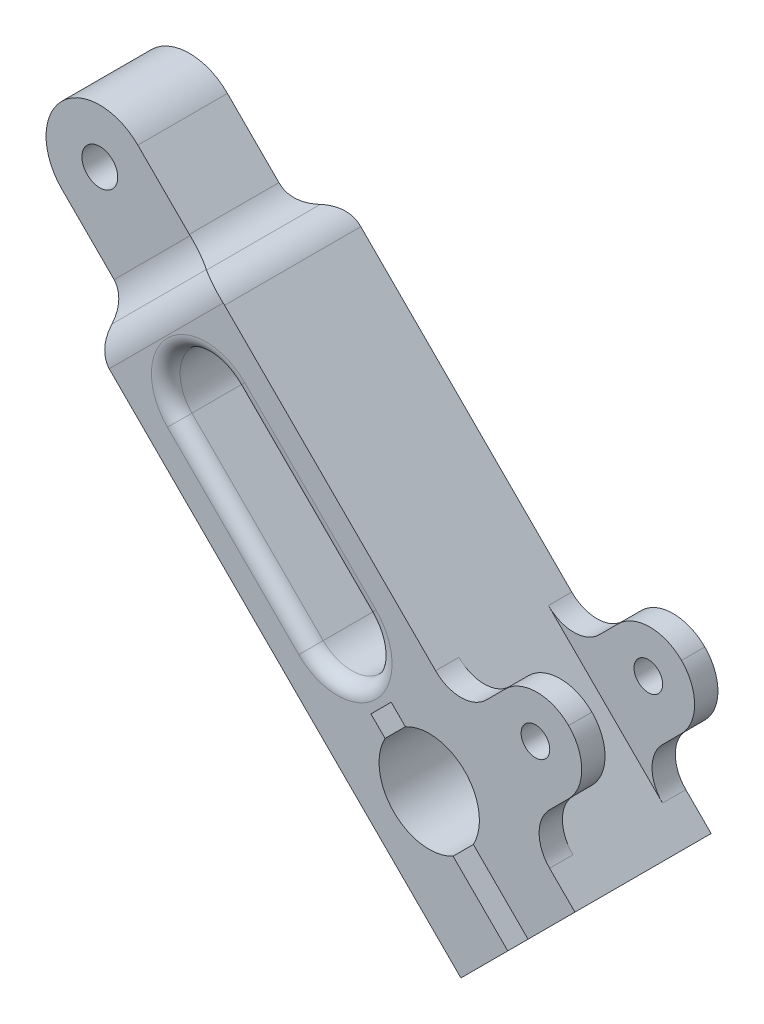
from build123d import *

# Parameters (mm, degrees)
BOSS_EXTRUDE1_DEPTH  = 38
SKETCH2_3_R          = 4
BOSS_EXTRUDE2_DEPTH  = 6.5
FILLET1_R            = 12.5
FILLET1_OF_MIRROR1_R = 12.5
SKETCH3_W            = 25
SKETCH3_H            = 30
BOSS_EXTRUDE3_DEPTH  = 45
SKETCH4_R            = 5
CUT_EXTRUDE1_DEPTH   = 231.178375709
FILLET2_R            = 15
SKETCH5_R            = 4
CUT_EXTRUDE2_DEPTH   = 10
FILLET3_R            = 10
FILLET4_R            = 10
CUT_EXTRUDE3_DEPTH   = 232.157597002
FILLET5_R            = 4


# Some blends are built 0.0001 mm under size
with BuildPart() as part:
    # Sketch2 → Boss-Extrude1 (new body)
    with BuildSketch(Plane.XY):
        with BuildLine():
            ThreePointArc((131.936514279, -126.279660029), (129.52074911, -109.721759237), (112.962848318, -107.305994068))
            Line((112.962848318, -107.305994068), (109.014652456, -103.357798206))
            Line((109.014652456, -103.357798206), (103.357798206, -109.014652456))
            Line((103.357798206, -109.014652456), (107.305994068, -112.962848318))
            ThreePointArc((107.305994068, -112.962848318), (109.721759237, -129.52074911), (126.279660029, -131.936514279))
            Line((126.279660029, -131.936514279), (141.54156439, -147.19841864))
            Line((141.54156439, -147.19841864), (128.460088938, -160.279894092))
            Line((128.460088938, -160.279894092), (114.317953314, -146.137758468))
            Line((114.317953314, -146.137758468), (26.516504294, -58.336309448))
            Line((26.516504294, -58.336309448), (31.819805153, -53.033008589))
            Line((31.819805153, -53.033008589), (53.033008589, -31.819805153))
            Line((53.033008589, -31.819805153), (58.336309448, -26.516504294))
            Line((58.336309448, -26.516504294), (128.460088938, -96.640283785))
            Line((128.460088938, -96.640283785), (146.137758468, -114.317953314))
            Line((146.137758468, -114.317953314), (160.279894092, -128.460088938))
            Line((160.279894092, -128.460088938), (147.19841864, -141.54156439))
            Line((147.19841864, -141.54156439), (131.936514279, -126.279660029))
        make_face()
    extrude(amount=BOSS_EXTRUDE1_DEPTH)

    # Sketch2<3> → Boss-Extrude2 (add)
    with BuildSketch(Plane.XY):
        Polygon((149.673292374, -75.427080349), (128.460088938, -96.640283785), (146.137758468, -114.317953314), (167.350961903, -93.104749879), align=None)
        with Locations(Location((149.25239548, -92.683852985, 0), (0, 0, 180))):
            Circle(SKETCH2_3_R, mode=Mode.SUBTRACT)
    boss_extrude2 = extrude(amount=BOSS_EXTRUDE2_DEPTH)

    # Fillet1
    fillet1_edges = [part.edges().sort_by_distance(p)[0] for p in [
        (167.350961903, -93.104749879, 3.25),
        (149.673292374, -75.427080349, 3.25),
    ]]
    fillet(fillet1_edges, radius=FILLET1_R - 0.0001)  # a hair under: the kernel refuses the full size

    # Mirror1: Boss-Extrude2 across plane
    add(boss_extrude2.mirror(Plane(origin=(0, 0, 19), x_dir=(1, 0, 0), z_dir=(0, 0, -1))))

    # Fillet1 of Mirror1
    fillet1_of_mirror1_edges = [part.edges().sort_by_distance(p)[0] for p in [
        (167.350961903, -93.104749879, 34.75),
        (149.673292374, -75.427080349, 34.75),
    ]]
    fillet(fillet1_of_mirror1_edges, radius=FILLET1_OF_MIRROR1_R - 0.0001)  # a hair under: the kernel refuses the full size

    # Sketch3 → Boss-Extrude3 (add)
    with BuildSketch(Plane(origin=(42.426406871, -42.426406871, 0), x_dir=(0, 0, 1), z_dir=(-0.7071067811865493, 0.7071067811865457, 0))):
        with Locations((19, 0)):
            Rectangle(SKETCH3_W, SKETCH3_H)
    extrude(amount=BOSS_EXTRUDE3_DEPTH)

    # Sketch4 → Cut-Extrude1 (cut, through all)
    with BuildSketch(Plane.XY.offset(31.5)):
        with Locations((21.213203436, -21.213203436)):
            Circle(SKETCH4_R)
    extrude(amount=-CUT_EXTRUDE1_DEPTH, mode=Mode.SUBTRACT)

    # Fillet2
    fillet2_edges = [part.edges().sort_by_distance(p)[0] for p in [
        (21.213203436, 0, 19),
        (0, -21.213203436, 19),
    ]]
    fillet(fillet2_edges, radius=FILLET2_R - 0.0001)  # a hair under: the kernel refuses the full size

    # Sketch5 → Cut-Extrude2 (cut)
    with BuildSketch(Plane(origin=(144.369991515, -144.369991515, 0), x_dir=(0, 0, -1), z_dir=(0.7071067811865477, -0.7071067811865475, 0))):
        with Locations(Location((-27, -13.25, 0), (0, 0, 90))):
            Circle(SKETCH5_R)
        with Locations(Location((-13, -13.25, 0), (0, 0, 90))):
            Circle(SKETCH5_R)
    extrude(amount=-CUT_EXTRUDE2_DEPTH, mode=Mode.SUBTRACT)

    # Fillet3
    # the kernel refuses this fillet: 10 mm, written as the material it adds along each edge
    with BuildSketch(Plane(origin=(128.460088938, -96.640283785, 0), x_dir=(-0.7071067811865476, 0.7071067811865476, 0), z_dir=(0, 0, 1)), Plane(origin=(146.137758468, -114.317953314, 38), x_dir=(0.7071067811865482, -0.7071067811865468, 0), z_dir=(0, 0, -1))) as fillet3_piece_1:
        with BuildLine():
            CenterArc((FILLET3_R, -FILLET3_R), FILLET3_R, 90, 90)
            Line((0, -FILLET3_R), (-FILLET3_R * 0.02, -FILLET3_R))
            Line((-FILLET3_R * 0.02, -FILLET3_R), (-FILLET3_R * 0.02, FILLET3_R * 0.02))
            Line((-FILLET3_R * 0.02, FILLET3_R * 0.02), (FILLET3_R, FILLET3_R * 0.02))
            Line((FILLET3_R, FILLET3_R * 0.02), (FILLET3_R, 0))
        make_face()
    extrude(amount=6.5)
    with BuildSketch(Plane(origin=(146.137758468, -114.317953314, 0), x_dir=(0.7071067811865482, -0.7071067811865468, 0), z_dir=(0, 0, 1)), Plane(origin=(128.460088938, -96.640283785, 38), x_dir=(-0.7071067811865476, 0.7071067811865476, 0), z_dir=(0, 0, -1))) as fillet3_piece_2:
        with BuildLine():
            CenterArc((FILLET3_R, FILLET3_R), FILLET3_R, 180, 90)
            Line((0, FILLET3_R), (-FILLET3_R * 0.02, FILLET3_R))
            Line((-FILLET3_R * 0.02, FILLET3_R), (-FILLET3_R * 0.02, -FILLET3_R * 0.02))
            Line((-FILLET3_R * 0.02, -FILLET3_R * 0.02), (FILLET3_R, -FILLET3_R * 0.02))
            Line((FILLET3_R, -FILLET3_R * 0.02), (FILLET3_R, 0))
        make_face()
    extrude(amount=6.5)
    with BuildSketch(Plane(origin=(53.033008589, -31.819805153, 31.5), x_dir=(0, 0, 1), z_dir=(-0.7071067811865457, -0.7071067811865493, 0))) as fillet3_piece_3:
        with BuildLine():
            CenterArc((10, 9.367496998), FILLET3_R, 180, 69.512684885)
            Line((0, 9.367496998), (-0.2, 9.367496998))
            Line((-0.2, 9.367496998), (-0.2, 0))
            Line((-0.2, 0), (0, -0.2))
            ThreePointArc((0, -0.2), (3.25, -0.2), (6.43, -0.18734994))
            Line((6.43, -0.18734994), (6.5, 0))
        make_face()
    extrude(amount=30)
    with BuildSketch(Plane(origin=(53.033008589, -31.819805153, 6.5), x_dir=(0.7071067811865468, 0.7071067811865482, 0), z_dir=(0, 0, 1))) as fillet3_piece_4:
        with BuildLine():
            CenterArc((10, 9.682458366), FILLET3_R, 180, 75.522487814)
            Line((0, 9.682458366), (-0.2, 9.682458366))
            Line((-0.2, 9.682458366), (-0.2, 0))
            Line((-0.2, 0), (0, -0.2))
            ThreePointArc((0, -0.2), (3.75, -0.2), (7.45, -0.193649167))
            Line((7.45, -0.193649167), (7.5, 0))
        make_face()
    extrude(amount=25)
    with BuildSketch(Plane(origin=(31.819805153, -53.033008589, 6.5), x_dir=(-0.7071067811865493, 0.7071067811865456, 0), z_dir=(0.7071067811865457, 0.7071067811865493, 0))) as fillet3_piece_5:
        with BuildLine():
            CenterArc((9.367496998, -10), FILLET3_R, 90, 69.512684885)
            Line((0, -6.5), (-0.18734994, -6.43))
            ThreePointArc((-0.18734994, -6.43), (-0.2, -3.25), (-0.2, 0))
            Line((-0.2, 0), (0, 0.2))
            Line((0, 0.2), (9.367496998, 0.2))
            Line((9.367496998, 0.2), (9.367496998, 0))
        make_face()
    extrude(amount=30)
    with BuildSketch(Plane(origin=(31.819805153, -53.033008589, 31.5), x_dir=(-0.7071067811865493, 0.7071067811865457, 0), z_dir=(0, 0, -1))) as fillet3_piece_6:
        with BuildLine():
            CenterArc((9.682458366, -10), FILLET3_R, 90, 75.522487814)
            Line((0, -7.5), (-0.193649167, -7.45))
            ThreePointArc((-0.193649167, -7.45), (-0.2, -3.75), (-0.2, 0))
            Line((-0.2, 0), (0, 0.2))
            Line((0, 0.2), (9.682458366, 0.2))
            Line((9.682458366, 0.2), (9.682458366, 0))
        make_face()
    extrude(amount=25)
    with BuildSketch(Plane(origin=(69.592560213, -15.260253529, 31.5), x_dir=(0, 0, 1), z_dir=(-0.7071067811865457, -0.7071067811865493, 0))) as fillet3_piece_7a_section:
        with BuildLine():
            CenterArc((10, 9.367496998), FILLET3_R, 180, 69.512684885)
            Line((0, 9.367496998), (-0.2, 9.367496998))
            Line((-0.2, 9.367496998), (-0.2, 0))
            Line((-0.2, 0), (0, -0.2))
            ThreePointArc((0, -0.2), (3.25, -0.2), (6.43, -0.18734994))
            Line((6.43, -0.18734994), (6.5, 0))
        make_face()
    fillet3_piece_7a = extrude(amount=53.418742494, mode=Mode.PRIVATE)
    fillet3_piece_7a = split(fillet3_piece_7a, bisect_by=Plane(origin=(56.741850223, -24.92204507, 33.172687928), z_dir=(-0.7071067811865472, -0.7071067811865478, 0)), keep=Keep.TOP, mode=Mode.PRIVATE)
    fillet3_piece_7a = split(fillet3_piece_7a, bisect_by=Plane(origin=(51.438549364, -30.225345929, 33.172687928), z_dir=(0.7071067811865457, 0.7071067811865493, 0)), keep=Keep.TOP, mode=Mode.PRIVATE)
    with BuildSketch(Plane(origin=(53.033008589, -31.819805153, 6.5), x_dir=(0.7071067811865468, 0.7071067811865482, 0), z_dir=(0, 0, 1))) as fillet3_piece_7b_section:
        with BuildLine():
            CenterArc((10, 9.682458366), FILLET3_R, 180, 75.522487814)
            Line((0, 9.682458366), (-0.2, 9.682458366))
            Line((-0.2, 9.682458366), (-0.2, 0))
            Line((-0.2, 0), (0, -0.2))
            ThreePointArc((0, -0.2), (3.75, -0.2), (7.45, -0.193649167))
            Line((7.45, -0.193649167), (7.5, 0))
        make_face()
    fillet3_piece_7b = extrude(amount=49.206145914, mode=Mode.PRIVATE)
    fillet3_piece_7b = split(fillet3_piece_7b, bisect_by=Plane(origin=(52.760402342, -28.865966585, 38), z_dir=(0, 0, -1)), keep=Keep.TOP, mode=Mode.PRIVATE)
    fillet3_piece_7b = split(fillet3_piece_7b, bisect_by=Plane(origin=(52.760402342, -28.865966585, 31.5), z_dir=(0, 0, 1)), keep=Keep.TOP, mode=Mode.PRIVATE)
    fillet3_piece_7 = fillet3_piece_7a & fillet3_piece_7b
    add(fillet3_piece_7)
    with BuildSketch(Plane(origin=(31.819805153, -53.033008589, 55.706145914), x_dir=(-0.7071067811865493, 0.7071067811865457, 0), z_dir=(0, 0, -1))) as fillet3_piece_8a_section:
        with BuildLine():
            CenterArc((9.682458366, -10), FILLET3_R, 90, 75.522487814)
            Line((0, -7.5), (-0.193649167, -7.45))
            ThreePointArc((-0.193649167, -7.45), (-0.2, -3.75), (-0.2, 0))
            Line((-0.2, 0), (0, 0.2))
            Line((0, 0.2), (9.682458366, 0.2))
            Line((9.682458366, 0.2), (9.682458366, 0))
        make_face()
    fillet3_piece_8a = extrude(amount=49.206145914, mode=Mode.PRIVATE)
    fillet3_piece_8a = split(fillet3_piece_8a, bisect_by=Plane(origin=(28.865966585, -52.760402342, 31.5), z_dir=(0, 0, 1)), keep=Keep.TOP, mode=Mode.PRIVATE)
    fillet3_piece_8a = split(fillet3_piece_8a, bisect_by=Plane(origin=(28.865966585, -52.760402342, 38), z_dir=(0, 0, -1)), keep=Keep.TOP, mode=Mode.PRIVATE)
    with BuildSketch(Plane(origin=(53.033008589, -31.819805153, 31.5), x_dir=(0, 0, 1), z_dir=(-0.7071067811865457, -0.7071067811865493, 0))) as fillet3_piece_8b_section:
        with BuildLine():
            CenterArc((10, 9.367496998), FILLET3_R, 180, 69.512684885)
            Line((0, 9.367496998), (-0.2, 9.367496998))
            Line((-0.2, 9.367496998), (-0.2, 0))
            Line((-0.2, 0), (0, -0.2))
            ThreePointArc((0, -0.2), (3.25, -0.2), (6.43, -0.18734994))
            Line((6.43, -0.18734994), (6.5, 0))
        make_face()
    fillet3_piece_8b = extrude(amount=53.418742494, mode=Mode.PRIVATE)
    fillet3_piece_8b = split(fillet3_piece_8b, bisect_by=Plane(origin=(30.225345929, -51.438549364, 33.172687928), z_dir=(-0.7071067811865457, -0.7071067811865493, 0)), keep=Keep.TOP, mode=Mode.PRIVATE)
    fillet3_piece_8b = split(fillet3_piece_8b, bisect_by=Plane(origin=(24.92204507, -56.741850223, 33.172687928), z_dir=(0.7071067811865476, 0.7071067811865476, 0)), keep=Keep.TOP, mode=Mode.PRIVATE)
    fillet3_piece_8 = fillet3_piece_8a & fillet3_piece_8b
    add(fillet3_piece_8)
    with BuildSketch(Plane(origin=(31.819805153, -53.033008589, 6.5), x_dir=(-0.7071067811865493, 0.7071067811865456, 0), z_dir=(0.7071067811865457, 0.7071067811865493, 0))) as fillet3_piece_9a_section:
        with BuildLine():
            CenterArc((9.367496998, -10), FILLET3_R, 90, 69.512684885)
            Line((0, -6.5), (-0.18734994, -6.43))
            ThreePointArc((-0.18734994, -6.43), (-0.2, -3.25), (-0.2, 0))
            Line((-0.2, 0), (0, 0.2))
            Line((0, 0.2), (9.367496998, 0.2))
            Line((9.367496998, 0.2), (9.367496998, 0))
        make_face()
    fillet3_piece_9a = extrude(amount=53.418742494, mode=Mode.PRIVATE)
    fillet3_piece_9a = split(fillet3_piece_9a, bisect_by=Plane(origin=(51.438549364, -30.225345929, 4.827312072), z_dir=(0.7071067811865457, 0.7071067811865493, 0)), keep=Keep.TOP, mode=Mode.PRIVATE)
    fillet3_piece_9a = split(fillet3_piece_9a, bisect_by=Plane(origin=(56.741850223, -24.92204507, 4.827312072), z_dir=(-0.7071067811865472, -0.7071067811865478, 0)), keep=Keep.TOP, mode=Mode.PRIVATE)
    with BuildSketch(Plane(origin=(53.033008589, -31.819805153, -17.706145914), x_dir=(0.707106781186548, 0.707106781186547, 0), z_dir=(0, 0, 1))) as fillet3_piece_9b_section:
        with BuildLine():
            CenterArc((10, 9.682458366), FILLET3_R, 180, 75.522487814)
            Line((0, 9.682458366), (-0.2, 9.682458366))
            Line((-0.2, 9.682458366), (-0.2, 0))
            Line((-0.2, 0), (0, -0.2))
            ThreePointArc((0, -0.2), (3.75, -0.2), (7.45, -0.193649167))
            Line((7.45, -0.193649167), (7.5, 0))
        make_face()
    fillet3_piece_9b = extrude(amount=49.206145914, mode=Mode.PRIVATE)
    fillet3_piece_9b = split(fillet3_piece_9b, bisect_by=Plane(origin=(52.760402342, -28.865966585, 6.5), z_dir=(0, 0, -1)), keep=Keep.TOP, mode=Mode.PRIVATE)
    fillet3_piece_9b = split(fillet3_piece_9b, bisect_by=Plane(origin=(52.760402342, -28.865966585, 0), z_dir=(0, 0, 1)), keep=Keep.TOP, mode=Mode.PRIVATE)
    fillet3_piece_9 = fillet3_piece_9a & fillet3_piece_9b
    add(fillet3_piece_9)
    with BuildSketch(Plane(origin=(15.260253529, -69.592560213, 6.5), x_dir=(-0.7071067811865495, 0.7071067811865456, 0), z_dir=(0.7071067811865457, 0.7071067811865493, 0))) as fillet3_piece_10a_section:
        with BuildLine():
            CenterArc((9.367496998, -10), FILLET3_R, 90, 69.512684885)
            Line((0, -6.5), (-0.18734994, -6.43))
            ThreePointArc((-0.18734994, -6.43), (-0.2, -3.25), (-0.2, 0))
            Line((-0.2, 0), (0, 0.2))
            Line((0, 0.2), (9.367496998, 0.2))
            Line((9.367496998, 0.2), (9.367496998, 0))
        make_face()
    fillet3_piece_10a = extrude(amount=53.418742494, mode=Mode.PRIVATE)
    fillet3_piece_10a = split(fillet3_piece_10a, bisect_by=Plane(origin=(30.225345929, -51.438549364, 4.827312072), z_dir=(-0.7071067811865457, -0.7071067811865493, 0)), keep=Keep.TOP, mode=Mode.PRIVATE)
    fillet3_piece_10a = split(fillet3_piece_10a, bisect_by=Plane(origin=(24.92204507, -56.741850223, 4.827312072), z_dir=(0.7071067811865476, 0.7071067811865476, 0)), keep=Keep.TOP, mode=Mode.PRIVATE)
    with BuildSketch(Plane(origin=(31.819805153, -53.033008589, 31.5), x_dir=(-0.7071067811865493, 0.7071067811865457, 0), z_dir=(0, 0, -1))) as fillet3_piece_10b_section:
        with BuildLine():
            CenterArc((9.682458366, -10), FILLET3_R, 90, 75.522487814)
            Line((0, -7.5), (-0.193649167, -7.45))
            ThreePointArc((-0.193649167, -7.45), (-0.2, -3.75), (-0.2, 0))
            Line((-0.2, 0), (0, 0.2))
            Line((0, 0.2), (9.682458366, 0.2))
            Line((9.682458366, 0.2), (9.682458366, 0))
        make_face()
    fillet3_piece_10b = extrude(amount=49.206145914, mode=Mode.PRIVATE)
    fillet3_piece_10b = split(fillet3_piece_10b, bisect_by=Plane(origin=(28.865966585, -52.760402342, 6.5), z_dir=(0, 0, -1)), keep=Keep.TOP, mode=Mode.PRIVATE)
    fillet3_piece_10b = split(fillet3_piece_10b, bisect_by=Plane(origin=(28.865966585, -52.760402342, 0), z_dir=(0, 0, 1)), keep=Keep.TOP, mode=Mode.PRIVATE)
    fillet3_piece_10 = fillet3_piece_10a & fillet3_piece_10b
    add(fillet3_piece_10)

    # Fillet4
    # the kernel refuses this fillet: 10 mm, written as the material it takes off along each edge
    with BuildSketch(Plane(origin=(67.862553767, -16.990259975, 0), x_dir=(-0.36915425795340573, 0.36915425795342965, 0.852906951355025), z_dir=(-0.7071067811866096, -0.7071067811864854, -3.3973892405453666e-14))) as fillet4_piece_1:
        with BuildLine():
            CenterArc((5.715746591, -9.81682366), FILLET4_R, 100.983417545, 47.545849796)
            Line((-2.813322922, -4.596194078), (0, 0))
            ThreePointArc((0, 0), (1.905248864, -0.18317634), (3.810497728, 0))
        make_face()
    extrude(amount=71.944287829, mode=Mode.SUBTRACT)
    with BuildSketch(Plane(origin=(26.516504294, -58.336309448, -14.825091576), x_dir=(0.7071067811865476, -0.7071067811865476, -1.0425413925659857e-13), z_dir=(0, 0, 1)), Plane(origin=(58.336309448, -26.516504294, 52.825091576), x_dir=(0.7071067811865475, -0.7071067811865475, 1.1813706204917057e-13), z_dir=(0, 0, -1))) as fillet4_piece_2:
        with BuildLine():
            CenterArc((5.93003663, 10), FILLET4_R, 218.682187453, 51.317812547)
            ThreePointArc((-1.876210868, 3.75), (-0.73934184, 1.974445977), (0, 0))
            Line((0, 0), (5.93003663, 0))
        make_face()
    extrude(amount=67.650183152, mode=Mode.SUBTRACT)
    with BuildSketch(Plane(origin=(31.819805153, -53.033008589, 38), x_dir=(0.7071067811866323, -0.7071067811864626, 5.274162303144569e-15), z_dir=(0.7071067811864628, 0.7071067811866324, 3.903248095108788e-14))) as fillet4_piece_3:
        with BuildLine():
            CenterArc((5.388857566, 10), FILLET4_R, 222.454150204, 47.545849796)
            ThreePointArc((-1.989319716, 3.25), (-0.838427484, 1.720629582), (0, 0))
            Line((0, 0), (5.388857566, 0))
        make_face()
    extrude(amount=50.972143914, mode=Mode.SUBTRACT)
    with BuildSketch(Plane(origin=(16.990259975, -67.862553767, 38), x_dir=(0.7071067811865479, -0.7071067811865472, 0), z_dir=(0.7071067811865472, 0.7071067811865479, 0))) as fillet4_piece_4:
        with BuildLine():
            CenterArc((5.388857566, 10), FILLET4_R, 222.454150204, 47.545849796)
            ThreePointArc((-1.989319716, 3.25), (-0.838427484, 1.720629582), (0, 0))
            Line((0, 0), (5.388857566, 0))
        make_face()
    extrude(amount=20.972143914, mode=Mode.SUBTRACT)

    # Sketch6 → Cut-Extrude3 (cut, through all)
    with BuildSketch(Plane(origin=(0, 0, 0), x_dir=(-1, 0, 0), z_dir=(0, 0, -1))):
        with BuildLine():
            Line((-49.411091223, -65.320993799), (-86.04395816, -101.953860737))
            ThreePointArc((-86.04395816, -101.953860737), (-101.953860737, -101.953860737), (-101.953860737, -86.04395816))
            Line((-101.953860737, -86.04395816), (-65.320993799, -49.411091223))
            ThreePointArc((-65.320993799, -49.411091223), (-49.411091223, -49.411091223), (-49.411091223, -65.320993799))
        make_face()
    extrude(amount=-CUT_EXTRUDE3_DEPTH, mode=Mode.SUBTRACT)

    # Fillet5
    fillet5_edges = [part.edges().sort_by_distance(p)[0] for p in [
        (49.411091223, -49.411091223, 38),
        (101.953860737, -101.953860737, 38),
        (83.637427268, -67.727524691, 38),
        (67.727524691, -83.637427268, 38),
        (67.727524691, -83.637427268, 0),
        (49.411091223, -49.411091223, 0),
        (83.637427268, -67.727524691, 0),
        (101.953860737, -101.953860737, 0),
    ]]
    fillet(fillet5_edges, radius=FILLET5_R)


solid = part.part
